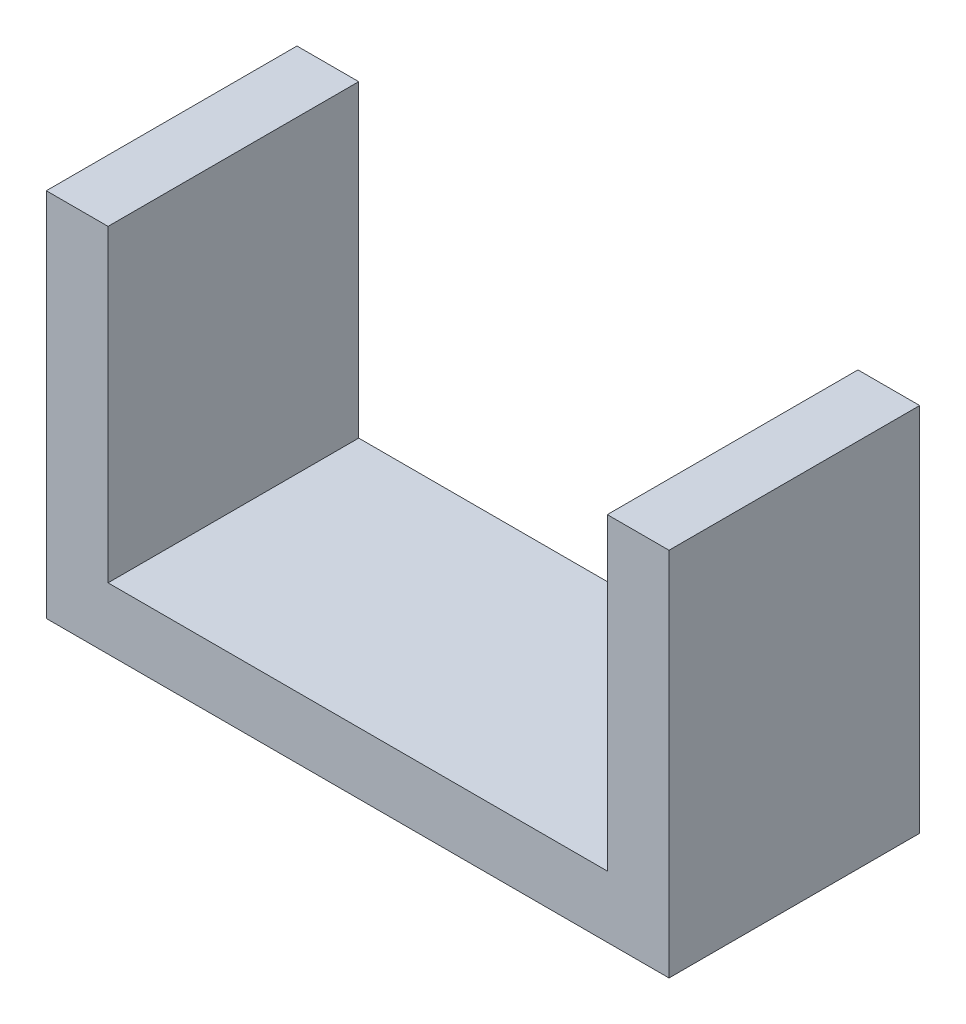
from build123d import *

# Parameters (mm, degrees)
SKETCH1_W            = 50.43
SKETCH1_H            = 20.3
YAWMOUNT_DEPTH       = 5
SKETCH2_W            = 5
SKETCH2_H            = 20.3
BODYCONNECTORS_DEPTH = 25


with BuildPart() as part:
    # Sketch1 → YawMount (new body)
    with BuildSketch(Plane(origin=(0, 0, 0), x_dir=(1, 0, 0), z_dir=(0, 1, 0))):
        with Locations((25.215, 10.15)):
            Rectangle(SKETCH1_W, SKETCH1_H)
    extrude(amount=YAWMOUNT_DEPTH)

    # Sketch2 → BodyConnectors (add)
    with BuildSketch(Plane(origin=(0, 5, 0), x_dir=(1, 0, 0), z_dir=(0, 1, 0))):
        with Locations((2.5, 10.15)):
            Rectangle(SKETCH2_W, SKETCH2_H)
        with Locations((47.93, 10.15)):
            Rectangle(SKETCH2_W, SKETCH2_H)
    extrude(amount=BODYCONNECTORS_DEPTH)


solid = part.part
